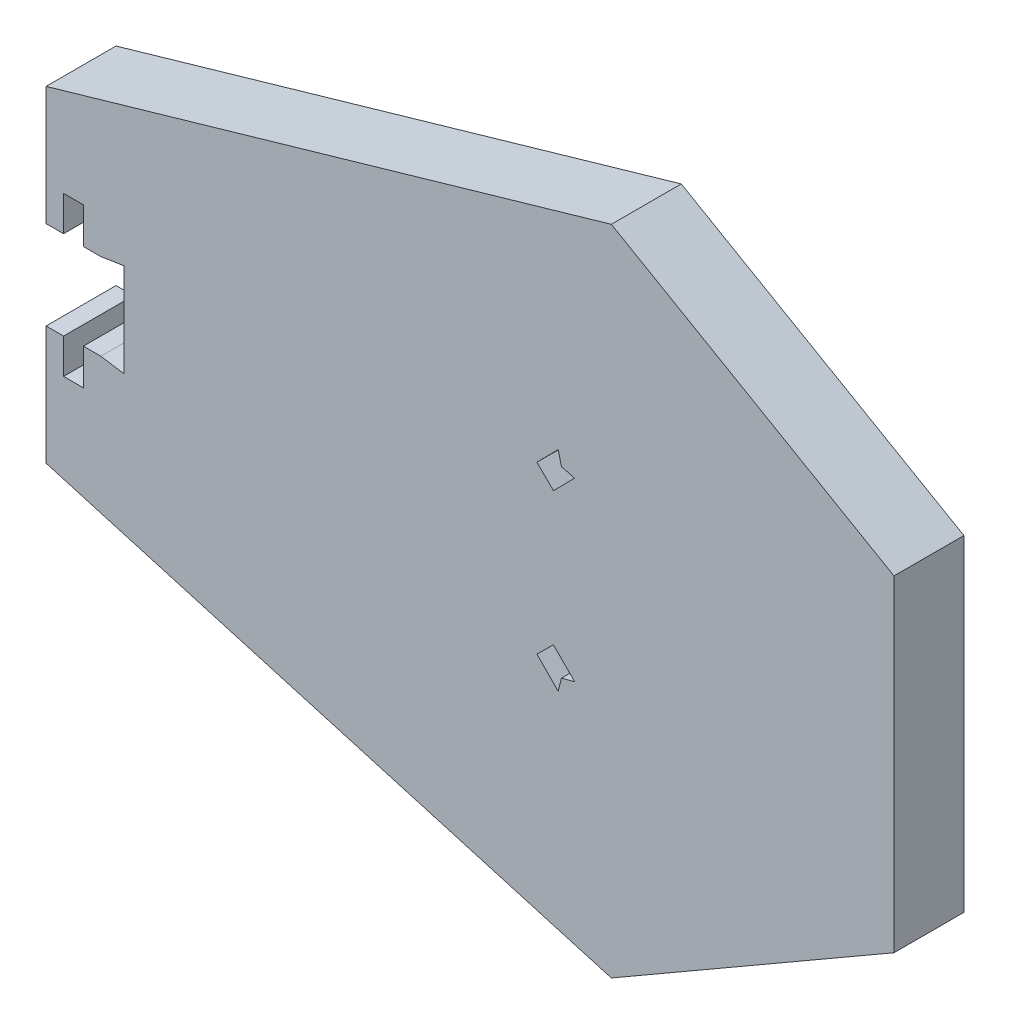
from build123d import *

# Parameters (mm, degrees)
BOSS_EXTRUDE1_DEPTH = 6
CUT_EXTRUDE1_DEPTH  = 51.439717383


with BuildPart() as part:
    # Sketch1 → Boss-Extrude1 (new body)
    with BuildSketch(Plane.XY):
        Polygon((31.223066959, 14), (6.974355653, 28), (-41.523066959, 14), (-41.523066959, 3.7), (-36.823066959, 3.7), (-34.823066959, 4.01574156), (-34.823066959, -4.01574156), (-36.823066959, -3.7), (-41.523066959, -3.7), (-41.523066959, -14), (6.974355653, -28), (31.223066959, -14), align=None)
        Polygon((2.408714576, 8.979109263), (2.700425446, 7.850425446), (3.819278422, 7.561255379), (2.009048725, 5.723949904), (0.584447895, 7.127556852), align=None, mode=Mode.SUBTRACT)
        Polygon((2.408714576, -8.979109263), (0.584447895, -7.127556852), (2.009048725, -5.723949904), (3.819278422, -7.561255379), (2.700425446, -7.850425446), align=None, mode=Mode.SUBTRACT)
    extrude(amount=BOSS_EXTRUDE1_DEPTH)

    # Sketch2 → Cut-Extrude1 (cut, through all)
    with BuildSketch(Plane.XY.offset(6)):
        Polygon((-41.623066959, -3.427539205), (-41.623066959, -3.8), (-40.023066959, -3.8), (-40.023066959, -6.8), (-38.323066959, -6.8), (-38.323066959, 6.8), (-40.023066959, 6.8), (-40.023066959, 3.8), (-41.623066959, 3.8), (-41.623066959, 3.427539205), align=None)
    extrude(amount=-CUT_EXTRUDE1_DEPTH, mode=Mode.SUBTRACT)


solid = part.part
